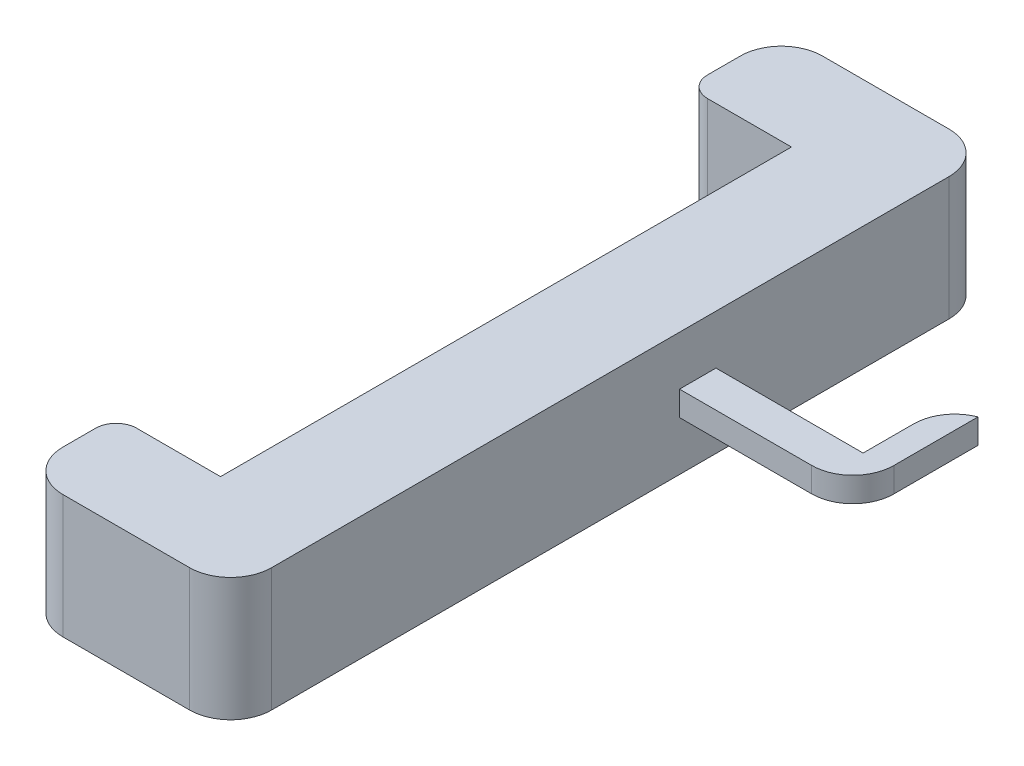
from build123d import *

# Parameters (mm, degrees)
BOSS_EXTRUDE1_DEPTH      = 15
BOSS_EXTRUDE1_DEPTH_BACK = 15
BOSS_EXTRUDE2_DEPTH      = 3
BOSS_EXTRUDE2_DEPTH_BACK = 3
FILLET1_R                = 10
FILLET2_R                = 5


with BuildPart() as part:
    # Sketch1 → Boss-Extrude1 (new, two sides: drawn at the far end of the back side and taken through both)
    with BuildSketch(Plane(origin=(0, 0, 0), x_dir=(1, 0, 0), z_dir=(0, 1, 0)).offset(-BOSS_EXTRUDE1_DEPTH_BACK)):
        Polygon((-106.717200023, 22.174603175), (-106.717200023, 45.125781111), (-55.917200023, 45.125781111), (-55.917200023, -139.682824762), (-106.717200023, -139.682824762), (-106.717200023, -116.731646825), (-81.317200023, -116.731646825), (-81.317200023, 22.174603175), align=None)
    extrude(amount=BOSS_EXTRUDE1_DEPTH + BOSS_EXTRUDE1_DEPTH_BACK)

    # Sketch1<3> → Boss-Extrude2 (add, two sides: drawn at the far end of the back side and taken through both)
    with BuildSketch(Plane(origin=(0, 0, 0), x_dir=(1, 0, 0), z_dir=(0, 1, 0)).offset(-BOSS_EXTRUDE2_DEPTH_BACK)):
        Polygon((-55.917200023, -21.59149981), (-55.917200023, -30.457986667), (-13.752700087, -30.457986667), (-13.752700087, 0), (-20.113440658, 0), (-20.113440658, -21.59149981), align=None)
    extrude(amount=BOSS_EXTRUDE2_DEPTH + BOSS_EXTRUDE2_DEPTH_BACK)

    # Fillet1
    # the kernel refuses this fillet: 10 mm, written as the material it takes off along each edge
    with BuildSketch(Plane(origin=(-106.717200023, 40, -45.125781111), x_dir=(0, 0, 1), z_dir=(0, -1, 0)), Plane(origin=(-55.917200023, 40, 139.682824762), x_dir=(0, 0, -1), z_dir=(0, -1, 0)), Plane(origin=(-55.917200023, 40, -45.125781111), x_dir=(-1, 0, 0), z_dir=(0, -1, 0)), Plane(origin=(-106.717200023, 40, 139.682824762), x_dir=(1, 0, 0), z_dir=(0, -1, 0))) as fillet1_piece_1:
        with BuildLine():
            CenterArc((FILLET1_R, -FILLET1_R), FILLET1_R, 90, 90)
            Line((0, -FILLET1_R), (-FILLET1_R * 0.02, -FILLET1_R))
            Line((-FILLET1_R * 0.02, -FILLET1_R), (-FILLET1_R * 0.02, FILLET1_R * 0.02))
            Line((-FILLET1_R * 0.02, FILLET1_R * 0.02), (FILLET1_R, FILLET1_R * 0.02))
            Line((FILLET1_R, FILLET1_R * 0.02), (FILLET1_R, 0))
        make_face()
    extrude(amount=80, mode=Mode.SUBTRACT)
    with BuildSketch(Plane(origin=(-13.752700087, -28, 30.457986667), x_dir=(-1, 0, 0), z_dir=(0, 1, 0))) as fillet1_piece_2:
        with BuildLine():
            CenterArc((FILLET1_R, -FILLET1_R), FILLET1_R, 90, 90)
            Line((0, -FILLET1_R), (-FILLET1_R * 0.02, -FILLET1_R))
            Line((-FILLET1_R * 0.02, -FILLET1_R), (-FILLET1_R * 0.02, FILLET1_R * 0.02))
            Line((-FILLET1_R * 0.02, FILLET1_R * 0.02), (FILLET1_R, FILLET1_R * 0.02))
            Line((FILLET1_R, FILLET1_R * 0.02), (FILLET1_R, 0))
        make_face()
    extrude(amount=56, mode=Mode.SUBTRACT)
    with BuildSketch(Plane(origin=(-20.113440658, 26.285697167, 0), x_dir=(1, 0, 0), z_dir=(0, -1, 0))) as fillet1_piece_3:
        with BuildLine():
            CenterArc((10, 9.314278867), FILLET1_R, 180, 68.658501665)
            Line((0, 9.314278867), (-0.2, 9.314278867))
            Line((-0.2, 9.314278867), (-0.2, 0))
            Line((-0.2, 0), (0, -0.2))
            ThreePointArc((0, -0.2), (3.180370286, -0.2), (6.287955383, -0.186285577))
            Line((6.287955383, -0.186285577), (6.360740571, 0))
        make_face()
    extrude(amount=52.571394335, mode=Mode.SUBTRACT)

    # Fillet2
    fillet2_edges = [part.edges().sort_by_distance(p)[0] for p in [
        (-106.717200023, 0, 116.731646825),
        (-106.717200023, 0, -22.174603175),
    ]]
    fillet(fillet2_edges, radius=FILLET2_R)


solid = part.part
